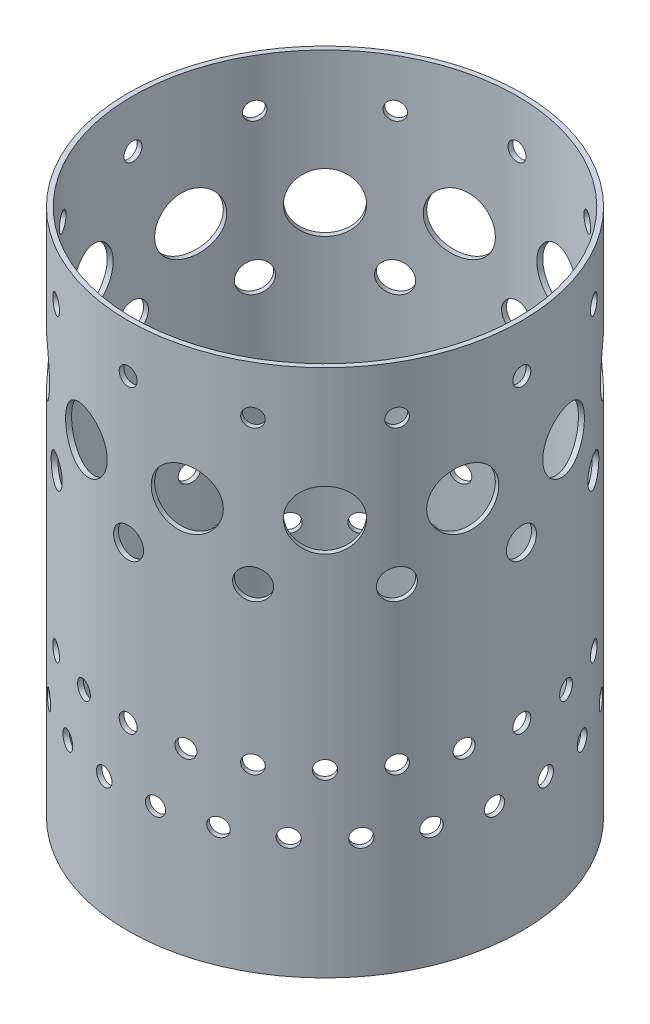
from build123d import *

# Parameters (mm, degrees)
SKETCH1_R           = 16.4
SKETCH1_R_2         = 16
EXTRUDE_THIN1_DEPTH = 44
SKETCH3_R           = 0.75
SKETCH3_R_2         = 1.25
CUT_EXTRUDE1_DEPTH  = 50.738516263
SKETCH4_R           = 0.75
SKETCH4_R_2         = 2.45
CUT_EXTRUDE2_DEPTH  = 50.738516417
SKETCH5_R           = 0.75
CUT_EXTRUDE3_DEPTH  = 50.738516417
SKETCH6_R           = 0.75
CUT_EXTRUDE4_DEPTH  = 50.738516417
CIRPATTERN2_COUNT   = 12


with BuildPart() as part:
    # Sketch1 → Extrude-Thin1 (new body)
    with BuildSketch(Plane(origin=(0, 0, 0), x_dir=(1, 0, 0), z_dir=(0, 1, 0))):
        Circle(SKETCH1_R)
        Circle(SKETCH1_R_2, mode=Mode.SUBTRACT)
    extrude(amount=EXTRUDE_THIN1_DEPTH)

    # Sketch3 → Cut-Extrude1 (cut, through all)
    with BuildSketch(Plane(origin=(0, 0, 0), x_dir=(0, 0, -1), z_dir=(1, 0, 0))):
        with Locations((0, 40)):
            Circle(SKETCH3_R)
        with Locations((0, 28)):
            Circle(SKETCH3_R_2)
        with Locations((0, 15)):
            Circle(SKETCH3_R)
    cut_extrude1 = extrude(amount=CUT_EXTRUDE1_DEPTH, mode=Mode.SUBTRACT)

    # Sketch4 → Cut-Extrude2 (cut, through all)
    with BuildSketch(Plane(origin=(0, 0, 0), x_dir=(0.25881904510252135, 0, -0.9659258262890681), z_dir=(0.9659258262890681, 0, 0.25881904510252135))):
        with Locations((0, 15)):
            Circle(SKETCH4_R)
        with Locations((0, 33)):
            Circle(SKETCH4_R_2)
    cut_extrude2 = extrude(amount=CUT_EXTRUDE2_DEPTH, mode=Mode.SUBTRACT)

    # Sketch5 → Cut-Extrude3 (cut, through all)
    with BuildSketch(Plane(origin=(0, 0, 0), x_dir=(0.13052619222005188, 0, -0.9914448613738104), z_dir=(0.9914448613738104, 0, 0.13052619222005188))):
        with Locations((0, 10)):
            Circle(SKETCH5_R)
    cut_extrude3 = extrude(amount=CUT_EXTRUDE3_DEPTH, mode=Mode.SUBTRACT)

    # Sketch6 → Cut-Extrude4 (cut, through all)
    with BuildSketch(Plane(origin=(0, 0, 0), x_dir=(-0.13052619222005188, 0, -0.9914448613738104), z_dir=(0.9914448613738104, 0, -0.13052619222005188))):
        with Locations((0, 10)):
            Circle(SKETCH6_R)
    cut_extrude4 = extrude(amount=CUT_EXTRUDE4_DEPTH, mode=Mode.SUBTRACT)

    # CirPattern2: Cut-Extrude1, Cut-Extrude2, Cut-Extrude3, Cut-Extrude4 ×12 about axis
    cirpattern2_axis = Axis((0, 44, 0), (0, -1, 0))
    add([cut_extrude1.rotate(cirpattern2_axis, i * 360 / CIRPATTERN2_COUNT) for i in range(1, CIRPATTERN2_COUNT)], mode=Mode.SUBTRACT)
    add([cut_extrude2.rotate(cirpattern2_axis, i * 360 / CIRPATTERN2_COUNT) for i in range(1, CIRPATTERN2_COUNT)], mode=Mode.SUBTRACT)
    add([cut_extrude3.rotate(cirpattern2_axis, i * 360 / CIRPATTERN2_COUNT) for i in range(1, CIRPATTERN2_COUNT)], mode=Mode.SUBTRACT)
    add([cut_extrude4.rotate(cirpattern2_axis, i * 360 / CIRPATTERN2_COUNT) for i in range(1, CIRPATTERN2_COUNT)], mode=Mode.SUBTRACT)


solid = part.part
